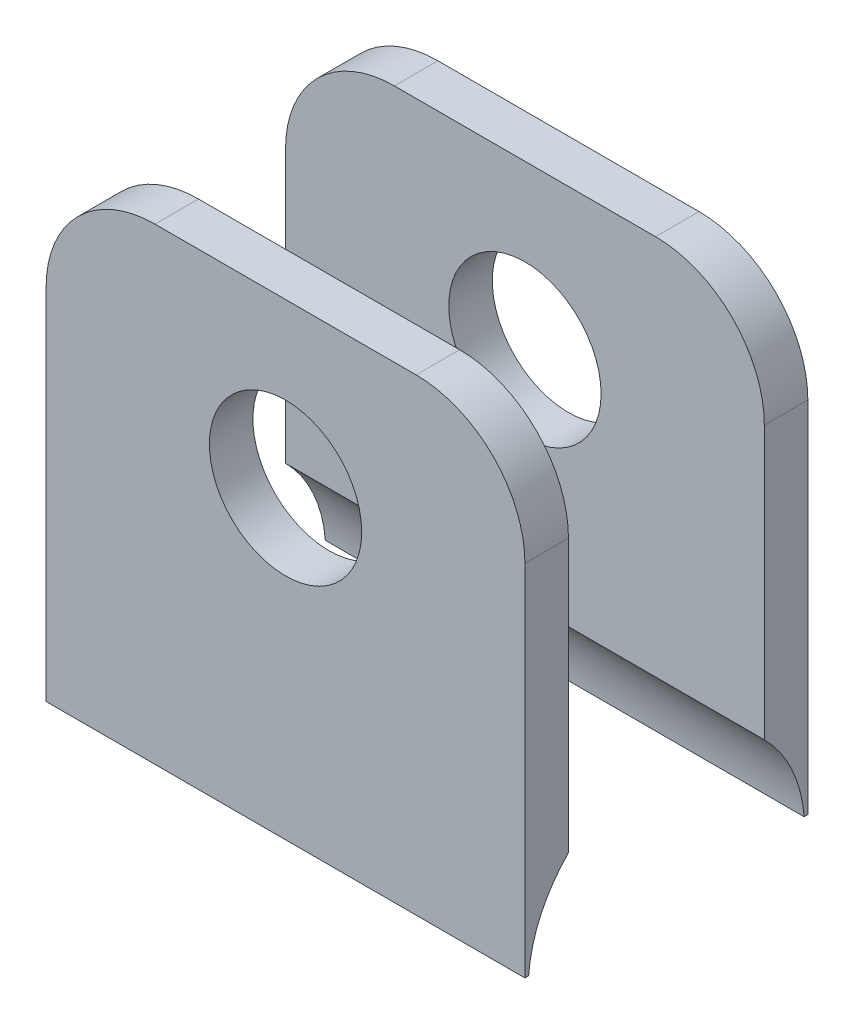
from build123d import *

# Parameters (mm, degrees)
SKETCH2_R               = 7
BOSS_EXTRUDE1_DEPTH     = 4
FILLET1_R               = 10
CUT_EXTRUDE1_DEPTH      = 25
CUT_EXTRUDE1_DEPTH_BACK = 25
SKETCH3_R               = 12.7


with BuildPart() as part:
    # Sketch2 → Boss-Extrude1 (new body)
    with BuildSketch(Plane.XY.offset(9)):
        Polygon((-22, 0), (-22, 15), (22, 15), (22, -28), (-22, -28), align=None)
        Circle(SKETCH2_R, mode=Mode.SUBTRACT)
    extrude(amount=BOSS_EXTRUDE1_DEPTH)

    # Fillet1
    fillet1_edges = [part.edges().sort_by_distance(p)[0] for p in [
        (22, 15, 11),
        (-22, 15, 11),
    ]]
    fillet(fillet1_edges, radius=FILLET1_R)


with BuildPart() as body_2:
    # Mirror2: mirrored copy
    add(part.part.mirror(Plane.XY))


with BuildPart() as cut_extrude1_tool:
    # Sketch3 → Cut-Extrude1 (new, two sides: drawn at the far end of the back side and taken through both)
    with BuildSketch(Plane(origin=(0, 0, 0), x_dir=(0, 0, -1), z_dir=(1, 0, 0)).offset(-CUT_EXTRUDE1_DEPTH_BACK)):
        with Locations((0, -29)):
            Circle(SKETCH3_R)
    extrude(amount=CUT_EXTRUDE1_DEPTH + CUT_EXTRUDE1_DEPTH_BACK)


with BuildPart() as part_1:
    add(part.part)

    # Cut-Extrude1: cut by cut_extrude1_tool
    add(cut_extrude1_tool.part, mode=Mode.SUBTRACT)


with BuildPart() as body_2_1:
    add(body_2.part)

    # Cut-Extrude1: cut by cut_extrude1_tool
    add(cut_extrude1_tool.part, mode=Mode.SUBTRACT)


solid = Compound([part_1.part, body_2_1.part])
